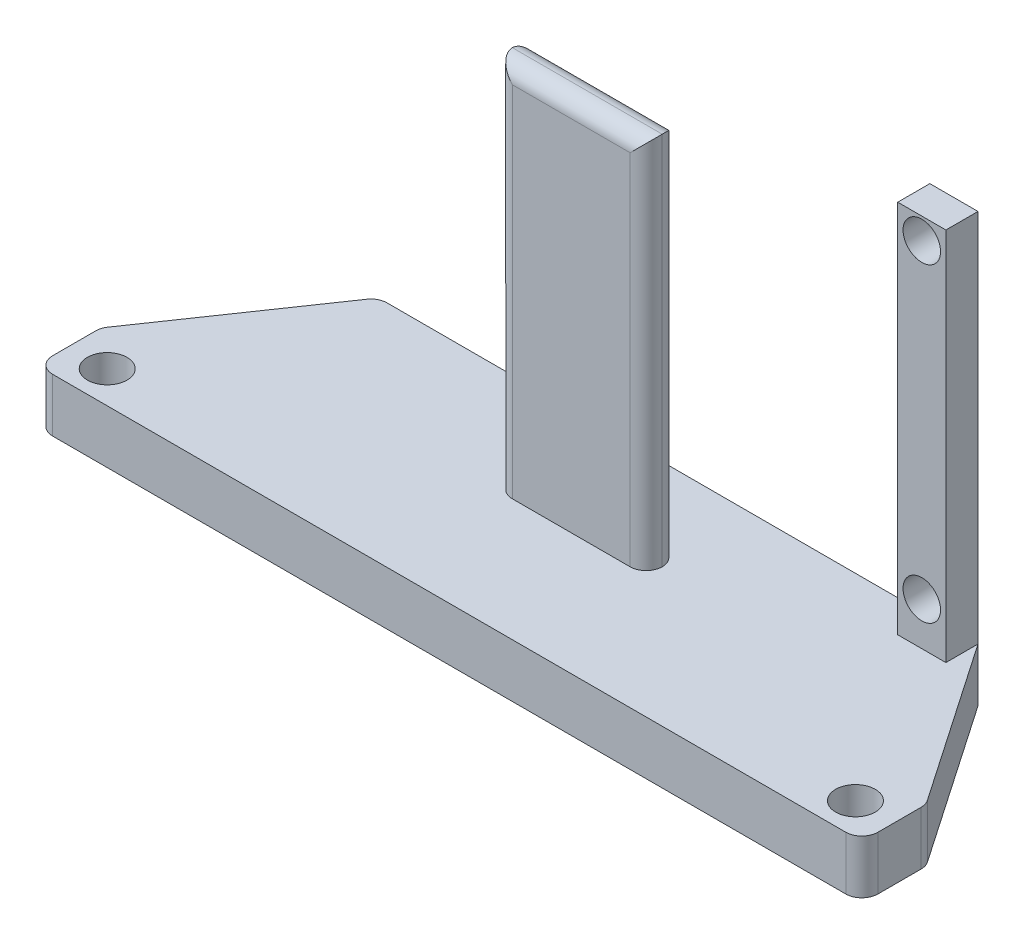
from build123d import *

# Parameters (mm, degrees)
SKETCH_1_R          = 1.85
EXTRUDE_1_DEPTH     = 5
SKETCH_2_W          = 4.5
SKETCH_2_H          = 3
SKETCH_2_W_2        = 14
EXTRUDE_2_DEPTH     = 35
SKETCH_4_R          = 1.75
CUT_EXTRUDE_2_DEPTH = 35
FILLET_3_R          = 1.5
FILLET_4_R          = 1.5


with BuildPart() as part:
    # 草图1 → 凸台-拉伸1 (new body)
    with BuildSketch(Plane(origin=(0, 0, 0), x_dir=(1, 0, 0), z_dir=(0, 1, 0))):
        Polygon((-38.55, 0), (38.55, 0), (38.55, 6), (28, 21.4), (-28, 21.4), (-38.55, 6), align=None)
        with Locations(Location((-34.95, 3, 0), (0, 0, 270))):
            Circle(SKETCH_1_R, mode=Mode.SUBTRACT)
        with Locations(Location((34.95, 3, 0), (0, 0, 270))):
            Circle(SKETCH_1_R, mode=Mode.SUBTRACT)
    extrude(amount=-EXTRUDE_1_DEPTH)

    # 草图2 → 凸台-拉伸2 (add)
    with BuildSketch(Plane(origin=(0, 0, 0), x_dir=(1, 0, 0), z_dir=(0, 1, 0))):
        with Locations((25.75, 19.9)):
            Rectangle(SKETCH_2_W, SKETCH_2_H)
        with Locations((0, 12.9)):
            Rectangle(SKETCH_2_W_2, SKETCH_2_H)
    extrude(amount=EXTRUDE_2_DEPTH)

    # 草图4 → 切除-拉伸2 (cut)
    with BuildSketch(Plane.XY.offset(-21.4)):
        with Locations(Location((25.75, 33, 0), (0, 0, 180))):
            Circle(SKETCH_4_R)
        with Locations(Location((25.75, 4, 0), (0, 0, 180))):
            Circle(SKETCH_4_R)
    extrude(amount=CUT_EXTRUDE_2_DEPTH, mode=Mode.SUBTRACT)

    # 圆角3
    fillet_3_edges = [part.edges().sort_by_distance(p)[0] for p in [
        (-7, 17.5, -14.4),
        (-7, 17.5, -11.4),
        (7, 17.5, -14.4),
        (7, 17.5, -11.4),
        (0, 35, -11.4),
        (0, 35, -14.4),
    ]]
    fillet(fillet_3_edges, radius=FILLET_3_R - 0.0001)  # a hair under: the kernel refuses the full size

    # 圆角4
    fillet_4_edges = [part.edges().sort_by_distance(p)[0] for p in [
        (-38.55, -2.5, -6),
        (-28, -2.5, -21.4),
        (38.55, -2.5, -6),
        (38.55, -2.5, 0),
        (-38.55, -2.5, 0),
    ]]
    fillet(fillet_4_edges, radius=FILLET_4_R)


solid = part.part
